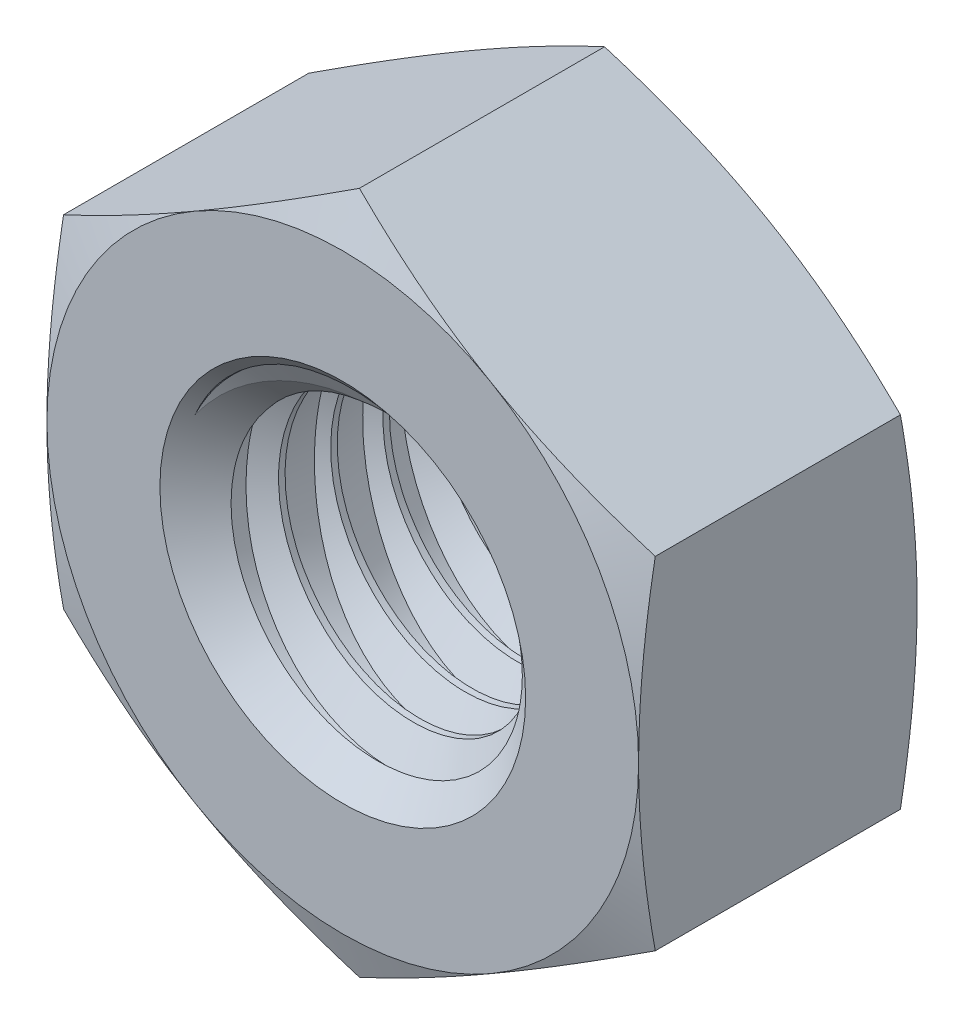
from build123d import *

# Parameters (mm, degrees)
EXTRUDE1_DEPTH      = 4
SKETCH2_OUTSIDE_W   = 113.732
SKETCH2_OUTSIDE_H   = 116.362
SKETCH2_OUTSIDE_R   = 8.5
CUT_EXTRUDE1_DEPTH  = 16.250683045
CUT_EXTRUDE1_DRAFT  = -70
SKETCH3_OUTSIDE_W   = 113.732
SKETCH3_OUTSIDE_H   = 116.362
SKETCH3_OUTSIDE_R   = 8.5
CUT_EXTRUDE2_DEPTH  = 16.250683045
CUT_EXTRUDE2_DRAFT  = -70
SKETCH16_W          = 2.666666666
SKETCH16_H          = 2.666666666
CUT_EXTRUDE10_DEPTH = 0.508
SWEEP1_PITCH        = 1.5
CUT_EXTRUDE4_DEPTH  = 29.615264111
CUT_EXTRUDE5_DEPTH  = 22.790670906
SKETCH13_R          = 5.254
CUT_EXTRUDE8_DEPTH  = 3
CUT_EXTRUDE8_DRAFT  = -50
SKETCH14_R          = 5.254
CUT_EXTRUDE9_DEPTH  = 3
CUT_EXTRUDE9_DRAFT  = -50


with BuildPart() as part:
    # Sketch1 → Extrude1 (new, symmetric)
    with BuildSketch(Plane.XY):
        Polygon((8.5, -4.907477288), (8.5, 4.907477288), (0, 9.814954576), (-8.5, 4.907477288), (-8.5, -4.907477288), (0, -9.814954576), align=None)
    extrude(amount=EXTRUDE1_DEPTH, both=True)


with BuildPart() as cut_extrude1_tool:
    # Sketch2 outside → Cut-Extrude1 (with draft: the straight prism first)
    with BuildSketch(Plane.XY.offset(4)):
        Rectangle(SKETCH2_OUTSIDE_W, SKETCH2_OUTSIDE_H)
        Circle(SKETCH2_OUTSIDE_R, mode=Mode.SUBTRACT)
    extrude(amount=-CUT_EXTRUDE1_DEPTH)
    # Cut-Extrude1: the draft: its side faces are tilted about the plane it starts from
    cut_extrude1_sides = [cut_extrude1_tool.faces().sort_by_distance(p)[0] for p in [
        (0, -58.181, -4.125341522),
        (56.866, 0, -4.125341522),
        (0, 58.181, -4.125341522),
        (-56.866, 0, -4.125341522),
        (-8.5, 0, -4.125341522),
    ]]
    draft(cut_extrude1_sides, Plane.XY.offset(4), CUT_EXTRUDE1_DRAFT)


with BuildPart() as part_1:
    add(part.part)

    # Cut-Extrude1: cut by cut_extrude1_tool
    add(cut_extrude1_tool.part, mode=Mode.SUBTRACT)


with BuildPart() as cut_extrude2_tool:
    # Sketch3 outside → Cut-Extrude2 (with draft: the straight prism first)
    with BuildSketch(Plane(origin=(0, 0, -4), x_dir=(-1, 0, 0), z_dir=(0, 0, -1))):
        Rectangle(SKETCH3_OUTSIDE_W, SKETCH3_OUTSIDE_H)
        Circle(SKETCH3_OUTSIDE_R, mode=Mode.SUBTRACT)
    extrude(amount=-CUT_EXTRUDE2_DEPTH)
    # Cut-Extrude2: the draft: its side faces are tilted about the plane it starts from
    cut_extrude2_sides = [cut_extrude2_tool.faces().sort_by_distance(p)[0] for p in [
        (0, -58.181, 4.125341522),
        (-56.866, 0, 4.125341522),
        (0, 58.181, 4.125341522),
        (56.866, 0, 4.125341522),
        (8.5, 0, 4.125341522),
    ]]
    draft(cut_extrude2_sides, Plane(origin=(0, 0, -4), x_dir=(-1, 0, 0), z_dir=(0, 0, -1)), CUT_EXTRUDE2_DRAFT)


with BuildPart() as part_2:
    add(part_1.part)

    # Cut-Extrude2: cut by cut_extrude2_tool
    add(cut_extrude2_tool.part, mode=Mode.SUBTRACT)

    # Sketch16 → Cut-Extrude10 (cut)
    with BuildSketch(Plane.ZY.offset(8.5)):
        Rectangle(SKETCH16_W, SKETCH16_H)
    extrude(amount=-CUT_EXTRUDE10_DEPTH, mode=Mode.SUBTRACT)

    # Cut-Loft1: read off the stored shape, not the designer's step
    # Cut-Loft1: loft between two sections, ruled curve by curve
    cut_loft1_from = [
        Edge.make_bspline([(4.554427165, -2.063296683, -4), (8.68102053, 7.045557647, -4), (-0.4278338, 11.172151012, -4), (-4.554427165, 2.063296683, -4), (-8.68102053, -7.045557647, -4), (0.4278338, -11.172151012, -4), (4.554427165, -2.063296683, -4)], [0, 0, 0, 0, 0.5, 0.5, 0.5, 1, 1, 1, 1], 3, [1, 0.333333333, 0.333333333, 1, 0.333333333, 0.333333333, 1]),
    ]
    cut_loft1_to = [
        Edge.make_bspline([(4.182437875, -0.806985655, 0), (5.550439957, 9.061909755, 0), (-2.814435792, 10.675881065, 0), (-4.182437875, 0.806985655, 0), (-5.550439957, -9.061909755, 0), (2.814435792, -10.675881065, 0), (4.182437875, -0.806985655, 0)], [0, 0, 0, 0, 0.5, 0.5, 0.5, 1, 1, 1, 1], 3, [1, 0.333333333, 0.333333333, 1, 0.333333333, 0.333333333, 1]),
    ]
    cut_loft1 = Solid(Shell([*[Face.make_surface_from_curves(cut_loft1_from[k], cut_loft1_to[k]) for k in range(1)], Face(Wire(cut_loft1_from)), Face(Wire(cut_loft1_to))]))
    add(cut_loft1, mode=Mode.SUBTRACT)

    # Mirror1: Cut-Loft1 across plane
    add(cut_loft1.mirror(Plane.XY), mode=Mode.SUBTRACT)

    # Sweep1: arcs per turn and ends read off the stored shape
    # Sweep1: the profile of Sketch9 screwed along a right-hand helix through 17 turns, 6 arcs to a turn; built about Z, then put on its axis
    sweep1_z = Axis((0, 0, 0), (0, 0, 1))
    sweep1_corners = [(5, 0, 0), (5, 0, -1.3125), (4.025721421, 0, -0.75), (4.025721421, 0, -0.5625)]
    with BuildLine(mode=Mode.PRIVATE) as sweep1_profile:
        Line(sweep1_corners[0], sweep1_corners[1])
        Line(sweep1_corners[1], sweep1_corners[2])
        Line(sweep1_corners[2], sweep1_corners[3])
        Line(sweep1_corners[3], sweep1_corners[0])
    sweep1_cap = Face(sweep1_profile.wire())
    sweep1_turn_angles = [0, 30, 60, 90, 120, 150, 180, 210, 240, 270, 300, 330, 360]
    sweep1_turn_weights = [1, 0.8660254037844387, 1, 0.8660254037844387, 1, 0.8660254037844387, 1, 0.8660254037844387, 1, 0.8660254037844387, 1, 0.8660254037844387, 1]
    sweep1_turn_rails = [Edge.make_bspline([Vector(p[0], p[1], 0).rotate(sweep1_z, sweep1_turn_angles[k]) / sweep1_turn_weights[k] + Vector(0, 0, p[2] + SWEEP1_PITCH * sweep1_turn_angles[k] / 360) for k in range(13)], [0, 0, 0, 1, 1, 2, 2, 3, 3, 4, 4, 5, 5, 6, 6, 6], 2, sweep1_turn_weights) for p in sweep1_corners]
    sweep1_turn_sides = [Face.make_surface_from_curves(sweep1_turn_rails[p[0]], sweep1_turn_rails[p[1]]) for p in [(0, 1), (1, 2), (2, 3), (3, 0)]]
    sweep1 = Plane(origin=(0, 0, -4), x_dir=(0, 1, 0), z_dir=(0, 0, 1)) * Solid(Shell([*[p.moved(Location((0, 0, SWEEP1_PITCH * i))) for i in range(17) for p in sweep1_turn_sides], sweep1_cap, sweep1_cap.rotate(sweep1_z, 6120).moved(Location((0, 0, SWEEP1_PITCH * 6120 / 360)))]))
    add(sweep1)

    # Sketch10 → Cut-Extrude4 (cut, through all)
    with BuildSketch(Plane(origin=(0, 0, -4), x_dir=(-1, 0, 0), z_dir=(0, 0, -1))):
        Polygon((-8.5, 4.907477288), (-8.5, -4.907477288), (0, -9.814954576), (8.5, -4.907477288), (8.5, 4.907477288), (0, 9.814954576), align=None)
    extrude(amount=CUT_EXTRUDE4_DEPTH, mode=Mode.SUBTRACT)

    # Sketch11 → Cut-Extrude5 (cut, through all)
    with BuildSketch(Plane.XY.offset(4)):
        with BuildLine():
            ThreePointArc((4.25, -7.361215932), (7.361215932, -4.25), (8.5, 0))
            ThreePointArc((8.5, 0), (7.361215932, 4.25), (4.25, 7.361215932))
            ThreePointArc((4.25, 7.361215932), (0, 8.5), (-4.25, 7.361215932))
            ThreePointArc((-4.25, 7.361215932), (-7.361215932, 4.25), (-8.5, 0))
            ThreePointArc((-8.5, 0), (-7.361215932, -4.25), (-4.25, -7.361215932))
            ThreePointArc((-4.25, -7.361215932), (0, -8.5), (4.25, -7.361215932))
        make_face()
    extrude(amount=CUT_EXTRUDE5_DEPTH, mode=Mode.SUBTRACT)


with BuildPart() as cut_extrude8_tool:
    # Sketch13 → Cut-Extrude8 (with draft: the straight prism first)
    with BuildSketch(Plane.XY.offset(4)):
        Circle(SKETCH13_R)
    extrude(amount=-CUT_EXTRUDE8_DEPTH)
    # Cut-Extrude8: the draft: its side faces are tilted about the plane it starts from
    cut_extrude8_sides = [cut_extrude8_tool.faces().sort_by_distance(p)[0] for p in [
        (-5.254, 0, 2.5),
    ]]
    draft(cut_extrude8_sides, Plane.XY.offset(4), CUT_EXTRUDE8_DRAFT)


with BuildPart() as part_3:
    add(part_2.part)

    # Cut-Extrude8: cut by cut_extrude8_tool
    add(cut_extrude8_tool.part, mode=Mode.SUBTRACT)


with BuildPart() as cut_extrude9_tool:
    # Sketch14 → Cut-Extrude9 (with draft: the straight prism first)
    with BuildSketch(Plane(origin=(0, 0, -4), x_dir=(-1, 0, 0), z_dir=(0, 0, -1))):
        Circle(SKETCH14_R)
    extrude(amount=-CUT_EXTRUDE9_DEPTH)
    # Cut-Extrude9: the draft: its side faces are tilted about the plane it starts from
    cut_extrude9_sides = [cut_extrude9_tool.faces().sort_by_distance(p)[0] for p in [
        (5.254, 0, -2.5),
    ]]
    draft(cut_extrude9_sides, Plane(origin=(0, 0, -4), x_dir=(-1, 0, 0), z_dir=(0, 0, -1)), CUT_EXTRUDE9_DRAFT)


with BuildPart() as part_4:
    add(part_3.part)

    # Cut-Extrude9: cut by cut_extrude9_tool
    add(cut_extrude9_tool.part, mode=Mode.SUBTRACT)


solid = part_4.part
